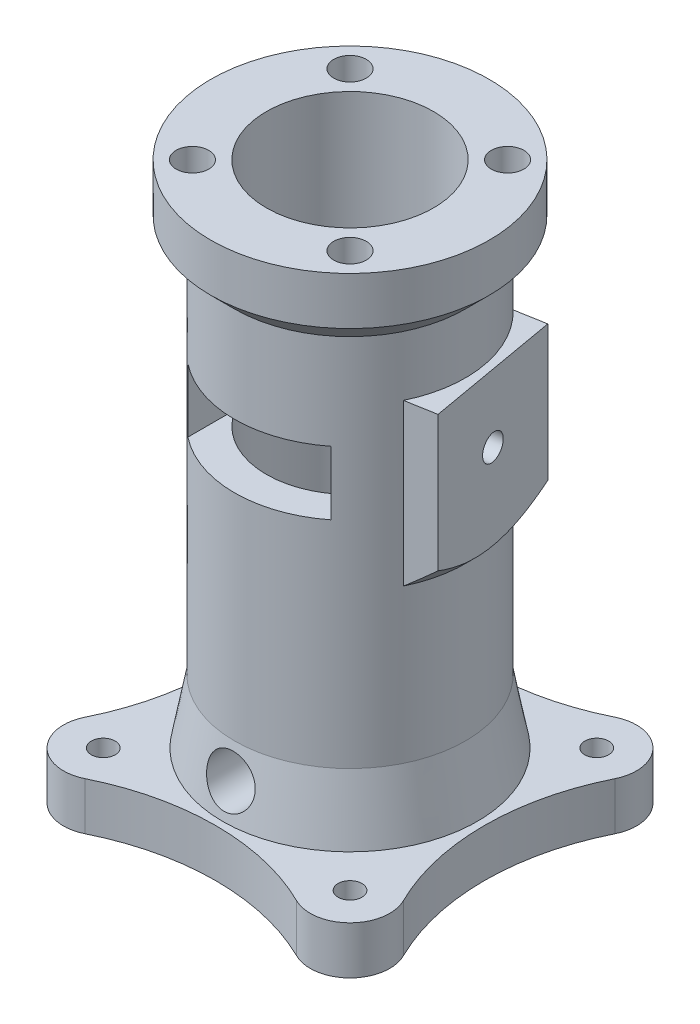
from build123d import *

# Parameters (mm, degrees)
SKETCH1_R                = 1.5
BOSS_EXTRUDE1_DEPTH      = 6
SKETCH3_R                = 14.5
SKETCH3_R_2              = 10.5
BOSS_EXTRUDE2_DEPTH      = 64
CHAMFER1_SIZE            = 1.5
CHAMFER1_SIZE2           = 8
BOSS_EXTRUDE3_START      = -6
SKETCH4_R                = 17.5
SKETCH4_R_2              = 14.5
BOSS_EXTRUDE3_DEPTH      = 6
CHAMFER2_SIZE            = 3
SKETCH5_R                = 2.05
CUT_EXTRUDE1_DEPTH       = 6
SKETCH6_R                = 1.6
CUT_EXTRUDE2_DEPTH       = 6
BOSS_EXTRUDE5_REACH      = 83.957
BOSS_EXTRUDE5_END_RADIUS = 14.5
SKETCH8_W                = 17
SKETCH8_H                = 17
SKETCH8_R                = 1.6
CHAMFER3_SIZE            = 3.2
CUT_EXTRUDE3_REACH       = 84.102
CUT_EXTRUDE3_END_RADIUS  = 10.5
SKETCH9_R                = 1.6
BOSS_EXTRUDE6_REACH      = 84.615
BOSS_EXTRUDE6_END_RADIUS = 14.5
SKETCH10_W               = 15
SKETCH10_H               = 15
SKETCH10_R               = 1.6
CHAMFER4_SIZE            = 3.2
CUT_EXTRUDE4_REACH       = 72.26
SKETCH12_R               = 10.5
CUT_EXTRUDE5_REACH       = 77.766
CUT_EXTRUDE5_END_RADIUS  = 14.5
SKETCH13_W               = 18
SKETCH13_H               = 8
SKETCH14_R               = 3
CUT_EXTRUDE6_DEPTH       = 76.766087493


# Some blends are built 0.0001 mm under size
with BuildPart() as part:
    # Sketch1 → Boss-Extrude1 (new body)
    with BuildSketch(Plane(origin=(0, 0, 0), x_dir=(1, 0, 0), z_dir=(0, 1, 0))):
        with BuildLine():
            ThreePointArc((13.285714286, 19.982960938), (0, 16.880726569), (-13.285714286, 19.982960938))
            ThreePointArc((-13.285714286, 19.982960938), (-19.035533906, 19.035533906), (-19.982960938, 13.285714286))
            ThreePointArc((-19.982960938, 13.285714286), (-16.880726569, 0), (-19.982960938, -13.285714286))
            ThreePointArc((-19.982960938, -13.285714286), (-19.035533906, -19.035533906), (-13.285714286, -19.982960938))
            ThreePointArc((-13.285714286, -19.982960938), (0, -16.880726569), (13.285714286, -19.982960938))
            ThreePointArc((13.285714286, -19.982960938), (19.035533906, -19.035533906), (19.982960938, -13.285714286))
            ThreePointArc((19.982960938, -13.285714286), (16.880726569, 0), (19.982960938, 13.285714286))
            ThreePointArc((19.982960938, 13.285714286), (19.035533906, 19.035533906), (13.285714286, 19.982960938))
        make_face()
        with Locations(Location((-15.5, -15.5, 0), (0, 0, 270))):
            Circle(SKETCH1_R, mode=Mode.SUBTRACT)
        with Locations(Location((15.5, -15.5, 0), (0, 0, 270))):
            Circle(SKETCH1_R, mode=Mode.SUBTRACT)
        with Locations(Location((-15.5, 15.5, 0), (0, 0, 270))):
            Circle(SKETCH1_R, mode=Mode.SUBTRACT)
        with Locations(Location((15.5, 15.5, 0), (0, 0, 270))):
            Circle(SKETCH1_R, mode=Mode.SUBTRACT)
    extrude(amount=BOSS_EXTRUDE1_DEPTH)

    # Sketch3 → Boss-Extrude2 (add)
    with BuildSketch(Plane(origin=(0, 6, 0), x_dir=(1, 0, 0), z_dir=(0, 1, 0))):
        with Locations(Location((0, 0, 0), (0, 0, 270))):
            Circle(SKETCH3_R)
        with Locations(Location((0, 0, 0), (0, 0, 270))):
            Circle(SKETCH3_R_2, mode=Mode.SUBTRACT)
    extrude(amount=BOSS_EXTRUDE2_DEPTH)

    # Chamfer1
    chamfer1_edges = [part.edges().sort_by_distance(p)[0] for p in [
        (0, 6, -14.5),
    ]]
    chamfer1_side = [part.faces().sort_by_distance(p)[0] for p in [
        (18.625533906, 6, -18.625533906),
    ]]
    chamfer(chamfer1_edges, length=CHAMFER1_SIZE, length2=CHAMFER1_SIZE2, reference=chamfer1_side[0])

    # Sketch4 → Boss-Extrude3 (add)
    with BuildSketch(Plane(origin=(0, 70, 0), x_dir=(1, 0, 0), z_dir=(0, 1, 0)).offset(BOSS_EXTRUDE3_START)):
        with Locations(Location((0, 0, 0), (0, 0, 270))):
            Circle(SKETCH4_R)
        with Locations(Location((0, 0, 0), (0, 0, 270))):
            Circle(SKETCH4_R_2, mode=Mode.SUBTRACT)
    extrude(amount=BOSS_EXTRUDE3_DEPTH)

    # Chamfer2
    chamfer2_edges = [part.edges().sort_by_distance(p)[0] for p in [
        (0, 64, -14.5),
    ]]
    chamfer(chamfer2_edges, length=CHAMFER2_SIZE - 0.0001)  # a hair under: the kernel refuses the full size

    # Sketch5 → Cut-Extrude1 (cut)
    with BuildSketch(Plane(origin=(0, 70, 0), x_dir=(1, 0, 0), z_dir=(0, 1, 0))):
        with Locations(Location((-9.899494937, 9.899494937, 0), (0, 0, 270))):
            Circle(SKETCH5_R)
        with Locations(Location((9.899494937, 9.899494937, 0), (0, 0, 270))):
            Circle(SKETCH5_R)
        with Locations(Location((9.899494937, -9.899494937, 0), (0, 0, 270))):
            Circle(SKETCH5_R)
        with Locations(Location((-9.899494937, -9.899494937, 0), (0, 0, 270))):
            Circle(SKETCH5_R)
    extrude(amount=-CUT_EXTRUDE1_DEPTH, mode=Mode.SUBTRACT)

    # Sketch6 → Cut-Extrude2 (cut)
    with BuildSketch(Plane(origin=(14.279712419, 0, -2.517898576), x_dir=(0, -1, 0), z_dir=(0.9848077530122086, 0, -0.17364817766692736))):
        with Locations(Location((-45, 0, 0), (0, 0, 90))):
            Circle(SKETCH6_R)
    extrude(amount=-CUT_EXTRUDE2_DEPTH, mode=Mode.SUBTRACT)

    # Boss-Extrude5: up to this cylinder (the profile starts outside it)
    boss_extrude5_end = Plane(origin=(0, 45, 0), z_dir=(0, -1, 0)) * Cylinder(BOSS_EXTRUDE5_END_RADIUS, 197.914, mode=Mode.PRIVATE)
    # Sketch8 → Boss-Extrude5 (add, up to the surface)
    with BuildSketch(Plane(origin=(15.264520172, 0, -2.691546754), x_dir=(0, -1, 0), z_dir=(0.9848077530122086, 0, -0.17364817766692736)), mode=Mode.PRIVATE) as boss_extrude5_sk1:
        with Locations((-45, 0)):
            Rectangle(SKETCH8_W, SKETCH8_H)
        with Locations(Location((-45, 0, 0), (0, 0, 90))):
            Circle(SKETCH8_R, mode=Mode.SUBTRACT)
    boss_extrude5_tool1 = extrude(boss_extrude5_sk1.sketch, amount=-BOSS_EXTRUDE5_REACH, mode=Mode.PRIVATE) - boss_extrude5_end
    add(boss_extrude5_tool1.solids().sort_by_distance((16.698782, 45, 5.442555))[0])

    # Chamfer3
    # the kernel refuses this chamfer: 3.2 mm, written as the material it adds along each edge
    with BuildSketch(Plane(origin=(0, 36.5, 0), x_dir=(0.20083050199504038, 0, -0.9796260048959603), z_dir=(-0.9796260048959603, 0, -0.20083050199504038))) as chamfer3_piece_1_section:
        Polygon((14.5, CHAMFER3_SIZE), (14.5 + CHAMFER3_SIZE, 0), (14.5, 0), align=None)
    chamfer3_piece_1 = revolve(axis=Axis((0, 36.5, 0), (0, -1, 0)), revolution_arc=136.828942556, mode=Mode.PRIVATE)
    chamfer3_piece_1 = split(chamfer3_piece_1, bisect_by=Plane(origin=(11.940348366, 33.784233454, -10.736531777), z_dir=(0.1736481776669274, 0, 0.9848077530122087)), keep=Keep.TOP, mode=Mode.PRIVATE)
    chamfer3_piece_1 = split(chamfer3_piece_1, bisect_by=Plane(origin=(14.892367386, 33.784233454, 6.005200024), z_dir=(-0.1736481776669274, 0, -0.9848077530122087)), keep=Keep.TOP, mode=Mode.PRIVATE)
    chamfer3_piece_1 = split(chamfer3_piece_1, bisect_by=Plane(origin=(14.206335343, 33.784233454, -8.692811132), z_dir=(-0.9848077530122086, 0, 0.17364817766692736)), keep=Keep.TOP, mode=Mode.PRIVATE)
    add(chamfer3_piece_1)

    # Cut-Extrude3: up to this cylinder (the profile starts outside it)
    cut_extrude3_end = Plane(origin=(0, 36, 0), z_dir=(0, -1, 0)) * Cylinder(CUT_EXTRUDE3_END_RADIUS, 190.204, mode=Mode.PRIVATE)
    # Sketch9 → Cut-Extrude3 (cut, up to the surface)
    with BuildSketch(Plane(origin=(-6.127964795, 0, -13.141462912), x_dir=(0, -1, 0), z_dir=(-0.4226182617407003, 0, -0.9063077870366496)), mode=Mode.PRIVATE) as cut_extrude3_sk1:
        with Locations(Location((-36, 0, 0), (0, 0, 90))):
            Circle(SKETCH9_R)
    cut_extrude3_tool1 = extrude(cut_extrude3_sk1.sketch, amount=-CUT_EXTRUDE3_REACH, mode=Mode.PRIVATE) - cut_extrude3_end
    add(cut_extrude3_tool1.solids().sort_by_distance((-6.127965, 36, -13.141463))[0], mode=Mode.SUBTRACT)

    # Boss-Extrude6: up to this cylinder (the profile starts outside it)
    boss_extrude6_end = Plane(origin=(0, 36, 0), z_dir=(0, -1, 0)) * Cylinder(BOSS_EXTRUDE6_END_RADIUS, 199.23, mode=Mode.PRIVATE)
    # Sketch10 → Boss-Extrude6 (add, up to the surface)
    with BuildSketch(Plane(origin=(-6.550583057, 0, -14.047770699), x_dir=(0, -1, 0), z_dir=(-0.4226182617407003, 0, -0.9063077870366496)), mode=Mode.PRIVATE) as boss_extrude6_sk1:
        with Locations((-36, 0)):
            Rectangle(SKETCH10_W, SKETCH10_H)
        with Locations(Location((-36, 0, 0), (0, 0, 90))):
            Circle(SKETCH10_R, mode=Mode.SUBTRACT)
    boss_extrude6_tool1 = extrude(boss_extrude6_sk1.sketch, amount=-BOSS_EXTRUDE6_REACH, mode=Mode.PRIVATE) - boss_extrude6_end
    add(boss_extrude6_tool1.solids().sort_by_distance((0.054468, 36, -17.127757))[0])

    # Chamfer4
    # the kernel refuses this chamfer: 3.2 mm, written as the material it adds along each edge
    with BuildSketch(Plane(origin=(0, 28.5, 0), x_dir=(0.6248545618954165, -1.4700884188140002e-15, -0.7807411712459431), z_dir=(0.7807411712459431, -1.7863424461528943e-15, 0.6248545618954165))) as chamfer4_piece_1_section:
        Polygon((14.5, -CHAMFER4_SIZE), (14.5 + CHAMFER4_SIZE, 0), (14.5, 0), align=None)
    chamfer4_piece_1 = revolve(axis=Axis((0, 28.5, 0), (0, 1, 0)), revolution_arc=127.343026959, mode=Mode.PRIVATE)
    chamfer4_piece_1 = split(chamfer4_piece_1, bisect_by=Plane(origin=(-12.659682405, 25.706017634, -9.402264656), z_dir=(0.9063077870366496, 0, -0.42261826174070033)), keep=Keep.TOP, mode=Mode.PRIVATE)
    chamfer4_piece_1 = split(chamfer4_piece_1, bisect_by=Plane(origin=(0.9349344, 25.706017634, -15.741538582), z_dir=(-0.9063077870366496, 0, 0.42261826174070033)), keep=Keep.TOP, mode=Mode.PRIVATE)
    chamfer4_piece_1 = split(chamfer4_piece_1, bisect_by=Plane(origin=(-1.74730187, 25.706017634, -16.287577501), z_dir=(0.4226182617407003, 0, 0.9063077870366496)), keep=Keep.TOP, mode=Mode.PRIVATE)
    add(chamfer4_piece_1)

    # Sketch12 → Cut-Extrude4 (cut, up to next)
    with BuildSketch(Plane(origin=(0, 6, 0), x_dir=(1, 0, 0), z_dir=(0, 1, 0)), mode=Mode.PRIVATE) as cut_extrude4_sk1:
        with Locations(Location((0, 0, 0), (0, 0, 270))):
            Circle(SKETCH12_R)
    cut_extrude4_tool1 = extrude(cut_extrude4_sk1.sketch, amount=-CUT_EXTRUDE4_REACH, mode=Mode.PRIVATE) & part.part
    add(cut_extrude4_tool1.solids().sort_by_distance((0, 6, 0))[0], mode=Mode.SUBTRACT)

    # Cut-Extrude5: up to this cylinder (the profile starts inside it)
    cut_extrude5_end = Plane(origin=(0, 45, 0), z_dir=(0, -1, 0)) * Cylinder(CUT_EXTRUDE5_END_RADIUS, 185.532, mode=Mode.PRIVATE)
    # Sketch13 → Cut-Extrude5 (cut, up to the surface)
    with BuildSketch(Plane.XY, mode=Mode.PRIVATE) as cut_extrude5_sk1:
        with Locations((0, 45)):
            Rectangle(SKETCH13_W, SKETCH13_H)
    cut_extrude5_tool1 = extrude(cut_extrude5_sk1.sketch, amount=CUT_EXTRUDE5_REACH, mode=Mode.PRIVATE) & cut_extrude5_end
    add(cut_extrude5_tool1.solids().sort_by_distance((0, 45, 0))[0], mode=Mode.SUBTRACT)

    # Sketch14 → Cut-Extrude6 (cut, through all)
    with BuildSketch(Plane.XY):
        with Locations(Location((0, 10, 0), (0, 0, 180))):
            Circle(SKETCH14_R)
    extrude(amount=CUT_EXTRUDE6_DEPTH, mode=Mode.SUBTRACT)


solid = part.part
